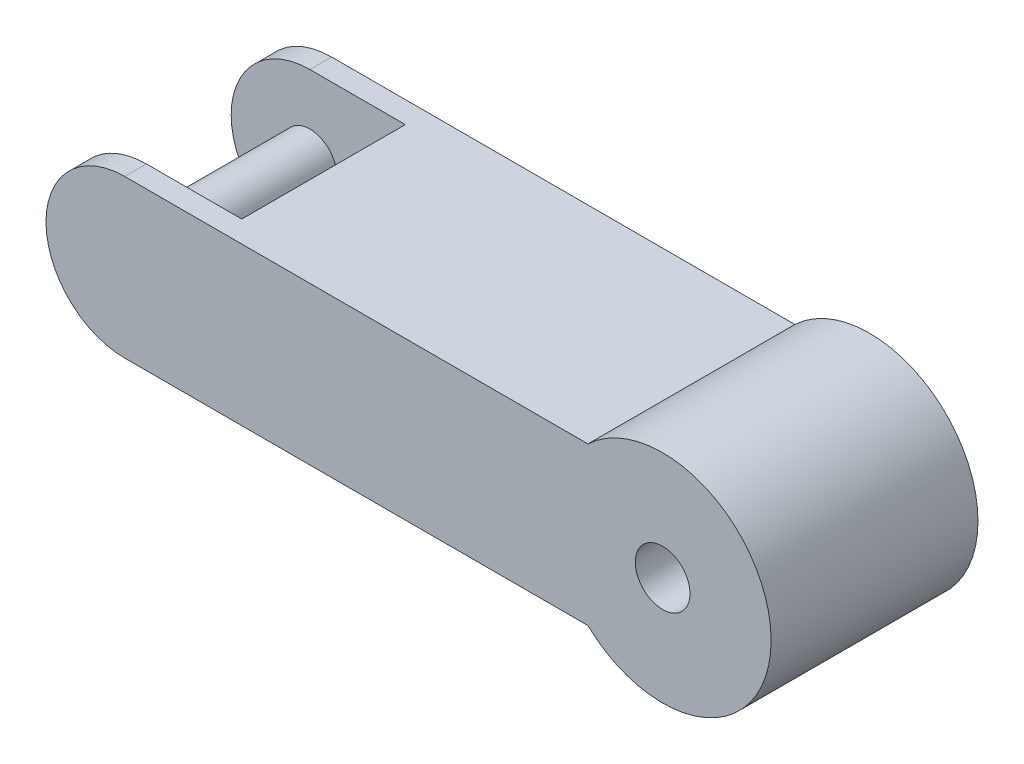
from build123d import *

# Parameters (mm, degrees)
BOSS_EXTRUDE1_DEPTH      = 4
BOSS_EXTRUDE2_DEPTH      = 15.075
SKETCH3_R                = 5.05
CUT_EXTRUDE1_DEPTH       = 51.075
BOSS_EXTRUDE3_DEPTH      = 32.075
BOSS_EXTRUDE3_DEPTH_BACK = 2
SKETCH4_R                = 5


with BuildPart() as part:
    # Sketch1 → Boss-Extrude1 (new body)
    with BuildSketch(Plane.XY):
        with BuildLine():
            Line((-99.203276416, -14.505051228), (-13.76965827, -14.505051228))
            ThreePointArc((-13.76965827, -14.505051228), (20, 0), (-13.76965827, 14.505051228))
            Line((-13.76965827, 14.505051228), (-99.203276416, 14.505051228))
            ThreePointArc((-99.203276416, 14.505051228), (-113.708327644, 0), (-99.203276416, -14.505051228))
        make_face()
    extrude(amount=BOSS_EXTRUDE1_DEPTH)

    # Sketch2 → Boss-Extrude2 (add)
    with BuildSketch(Plane.XY.offset(4)):
        with BuildLine():
            Line((-13.76965827, 14.505051228), (-81.604060492, 14.505051228))
            ThreePointArc((-81.604060492, 14.505051228), (-67.970381175, 0), (-81.604060492, -14.505051228))
            Line((-81.604060492, -14.505051228), (-13.76965827, -14.505051228))
            ThreePointArc((-13.76965827, -14.505051228), (20, 0), (-13.76965827, 14.505051228))
        make_face()
    extrude(amount=BOSS_EXTRUDE2_DEPTH)

    # Mirror1: part across plane


with BuildPart() as part_1:
    add(part.part)
    add(part.part.mirror(Plane.XY.offset(19.075)))

    # Sketch3 → Cut-Extrude1 (cut)
    with BuildSketch(Plane(origin=(0, 0, 0), x_dir=(-1, 0, 0), z_dir=(0, 0, -1))):
        Circle(SKETCH3_R)
    extrude(amount=-CUT_EXTRUDE1_DEPTH, mode=Mode.SUBTRACT)

    # Sketch4 → Boss-Extrude3 (add, two sides: drawn at the far end of the back side and taken through both)
    with BuildSketch(Plane(origin=(0, 0, 34.15), x_dir=(-1, 0, 0), z_dir=(0, 0, -1)).offset(-BOSS_EXTRUDE3_DEPTH_BACK)):
        with Locations((99.203276416, 0)):
            Circle(SKETCH4_R)
    extrude(amount=BOSS_EXTRUDE3_DEPTH + BOSS_EXTRUDE3_DEPTH_BACK)


solid = part_1.part
